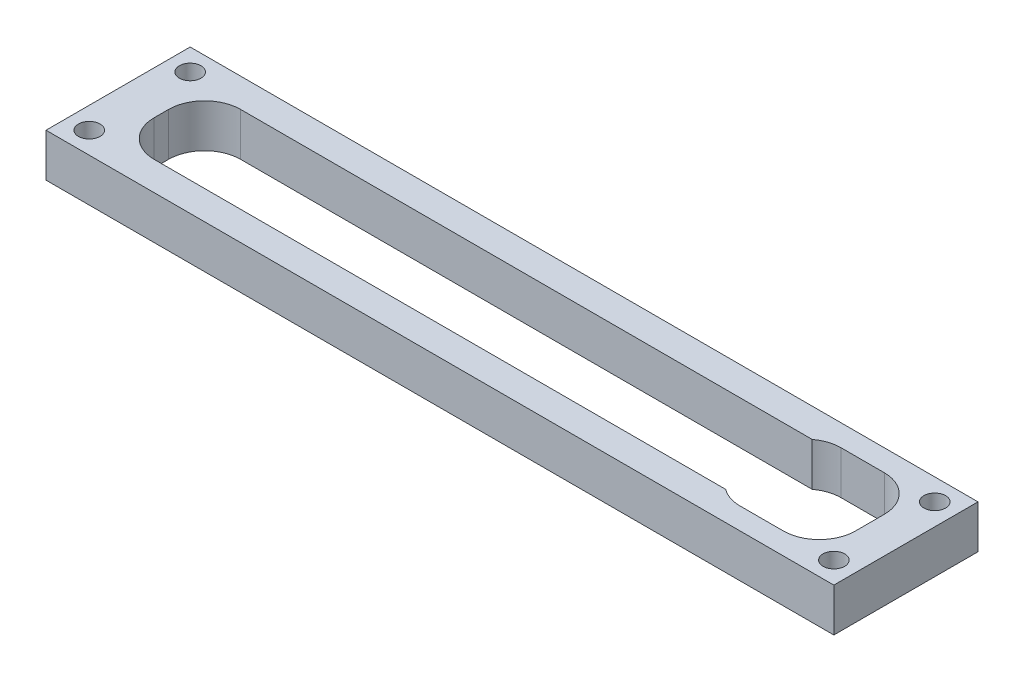
from build123d import *

# Parameters (mm, degrees)
SKETCH1_W           = 109.295835398
SKETCH1_H           = 20
SKETCH1_R           = 1.5
SKETCH1_W_2         = 97.295835398
SKETCH1_H_2         = 12
BOSS_EXTRUDE1_DEPTH = 6
CUT_EXTRUDE1_DEPTH  = 112.272546639
FILLET1_R           = 5


with BuildPart() as part:
    # Sketch1 → Boss-Extrude1 (new body)
    with BuildSketch(Plane(origin=(0, 0, 0), x_dir=(1, 0, 0), z_dir=(0, 1, 0))):
        with Locations((54.647917699, 10)):
            Rectangle(SKETCH1_W, SKETCH1_H)
        with Locations(Location((3, 17, 0), (0, 0, 270))):
            Circle(SKETCH1_R, mode=Mode.SUBTRACT)
        with Locations(Location((3, 3, 0), (0, 0, 90))):
            Circle(SKETCH1_R, mode=Mode.SUBTRACT)
        with Locations(Location((106.295835398, 3, 0), (0, 0, 270))):
            Circle(SKETCH1_R, mode=Mode.SUBTRACT)
        with Locations(Location((106.295835398, 17, 0), (0, 0, 90))):
            Circle(SKETCH1_R, mode=Mode.SUBTRACT)
        with Locations((54.647917699, 10)):
            Rectangle(SKETCH1_W_2, SKETCH1_H_2, mode=Mode.SUBTRACT)
    extrude(amount=BOSS_EXTRUDE1_DEPTH)

    # Sketch2 → Cut-Extrude1 (cut, through all)
    with BuildSketch(Plane(origin=(0, 6, 0), x_dir=(1, 0, 0), z_dir=(0, 1, 0))):
        Polygon((90.295835398, 17), (90.295835398, 16), (103.295835398, 16), (103.295835398, 4), (90.295835398, 4), (90.295835398, 3), (104.295835398, 3), (104.295835398, 17), align=None)
    extrude(amount=-CUT_EXTRUDE1_DEPTH, mode=Mode.SUBTRACT)

    # Fillet1
    # the kernel refuses this fillet: 5 mm, written as the material it adds along each edge
    with BuildSketch(Plane(origin=(104.295835398, 6, -17), x_dir=(0, 0, 1), z_dir=(0, -1, 0)), Plane(origin=(104.295835398, 6, -3), x_dir=(-1, 0, 0), z_dir=(0, -1, 0)), Plane(origin=(6, 0, -16), x_dir=(0, 0, 1), z_dir=(0, 1, 0))) as fillet1_piece_1:
        with BuildLine():
            CenterArc((FILLET1_R, FILLET1_R), FILLET1_R, 180, 90)
            Line((0, FILLET1_R), (-FILLET1_R * 0.02, FILLET1_R))
            Line((-FILLET1_R * 0.02, FILLET1_R), (-FILLET1_R * 0.02, -FILLET1_R * 0.02))
            Line((-FILLET1_R * 0.02, -FILLET1_R * 0.02), (FILLET1_R, -FILLET1_R * 0.02))
            Line((FILLET1_R, -FILLET1_R * 0.02), (FILLET1_R, 0))
        make_face()
    extrude(amount=6)
    with BuildSketch(Plane(origin=(90.295835398, 6, -17), x_dir=(1, 0, 0), z_dir=(0, -1, 0))) as fillet1_piece_2:
        with BuildLine():
            CenterArc((3, 5), FILLET1_R, 233.130102354, 36.869897646)
            Line((0, 1), (-0.06, 0.92))
            ThreePointArc((-0.06, 0.92), (-0.1, 0.5), (-0.1, 0))
            Line((-0.1, 0), (0, -0.1))
            Line((0, -0.1), (3, -0.1))
            Line((3, -0.1), (3, 0))
        make_face()
    extrude(amount=6)
    with BuildSketch(Plane(origin=(90.295835398, 6, -3), x_dir=(0, 0, -1), z_dir=(0, -1, 0))) as fillet1_piece_3:
        with BuildLine():
            CenterArc((5, 3), FILLET1_R, 180, 36.869897646)
            Line((0, 3), (-0.1, 3))
            Line((-0.1, 3), (-0.1, 0))
            Line((-0.1, 0), (0, -0.1))
            ThreePointArc((0, -0.1), (0.5, -0.1), (0.92, -0.06))
            Line((0.92, -0.06), (1, 0))
        make_face()
    extrude(amount=6)
    with BuildSketch(Plane(origin=(6, 0, -4), x_dir=(0, 0, -1), z_dir=(0, 1, 0))) as fillet1_piece_4:
        with BuildLine():
            CenterArc((FILLET1_R, -FILLET1_R), FILLET1_R, 90, 90)
            Line((0, -FILLET1_R), (-FILLET1_R * 0.02, -FILLET1_R))
            Line((-FILLET1_R * 0.02, -FILLET1_R), (-FILLET1_R * 0.02, FILLET1_R * 0.02))
            Line((-FILLET1_R * 0.02, FILLET1_R * 0.02), (FILLET1_R, FILLET1_R * 0.02))
            Line((FILLET1_R, FILLET1_R * 0.02), (FILLET1_R, 0))
        make_face()
    extrude(amount=6)


solid = part.part
